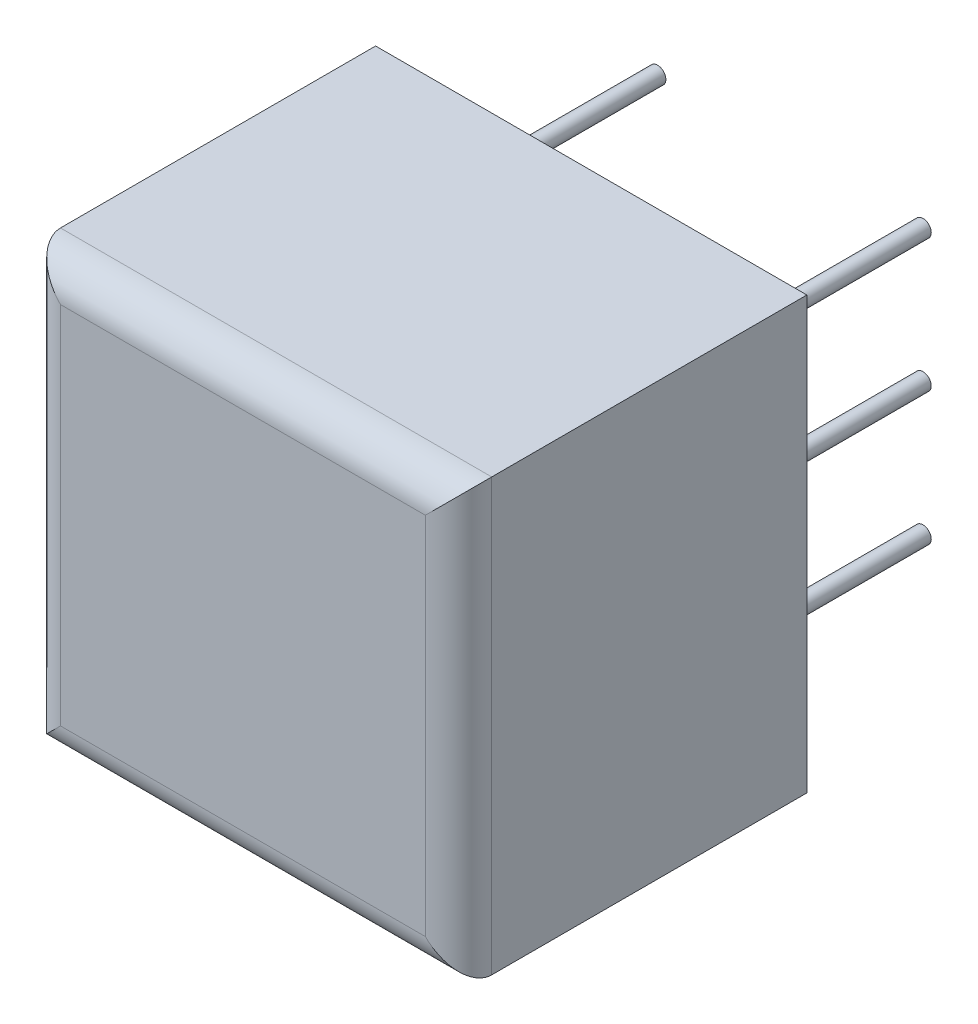
from build123d import *

# Parameters (mm, degrees)
SKETCH_1_W      = 26
SKETCH_1_H      = 26
EXTRUDE_1_DEPTH = 21
FILLET_1_R      = 2
SKETCH_2_R      = 0.5
EXTRUDE_2_DEPTH = 12


with BuildPart() as part:
    # 草图1 → 凸台-拉伸1 (new body)
    with BuildSketch(Plane.XY):
        Rectangle(SKETCH_1_W, SKETCH_1_H)
    extrude(amount=EXTRUDE_1_DEPTH)

    # 圆角1
    fillet_1_edges = [part.edges().sort_by_distance(p)[0] for p in [
        (13, 0, 21),
        (0, 13, 21),
        (-13, 0, 21),
        (0, -13, 21),
    ]]
    fillet(fillet_1_edges, radius=FILLET_1_R)

    # 草图2 → 凸台-拉伸2 (add)
    with BuildSketch(Plane(origin=(0, 0, 0), x_dir=(-1, 0, 0), z_dir=(0, 0, -1))):
        with Locations((-8, 8)):
            Circle(SKETCH_2_R)
        with Locations((-8, 0)):
            Circle(SKETCH_2_R)
        with Locations((-8, -8)):
            Circle(SKETCH_2_R)
        with Locations((8, -8)):
            Circle(SKETCH_2_R)
        with Locations((8, 8)):
            Circle(SKETCH_2_R)
    extrude(amount=EXTRUDE_2_DEPTH)


solid = part.part
